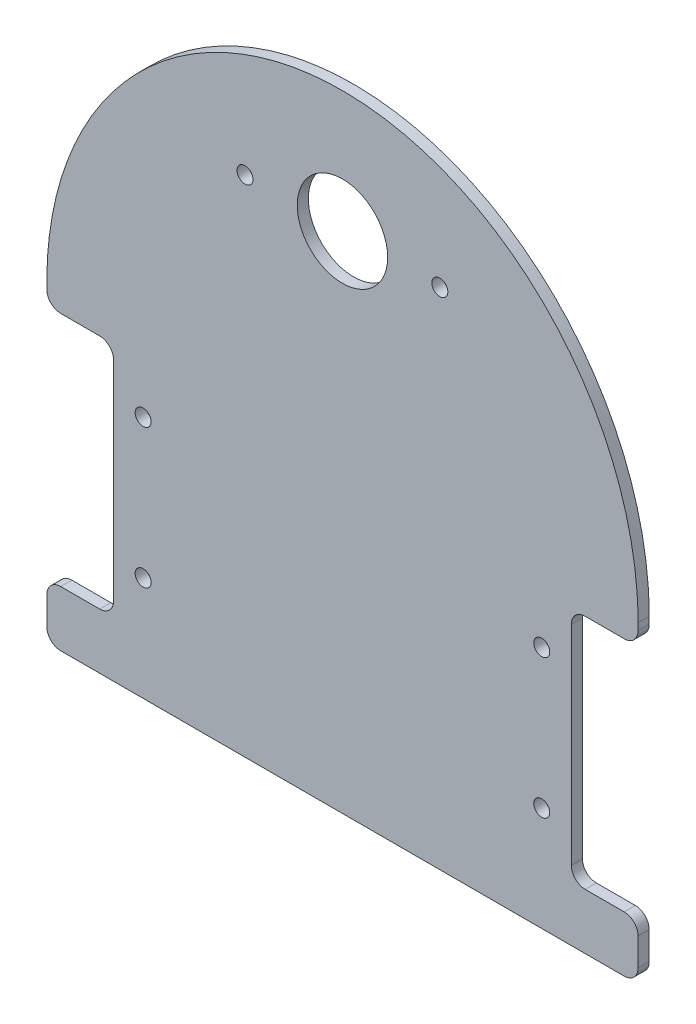
from build123d import *

# Parameters (mm, degrees)
SKETCH1_W           = 85
SKETCH1_H           = 90
BOSS_EXTRUDE1_DEPTH = 1.6
CUT_EXTRUDE1_DEPTH  = 62.917768048
SKETCH3_W           = 9.6
SKETCH3_H           = 34
CUT_EXTRUDE2_DEPTH  = 62.917768192
SKETCH4_R           = 6.5
CUT_EXTRUDE3_DEPTH  = 62.917768192
SKETCH5_R           = 1.15
CUT_EXTRUDE4_DEPTH  = 62.917768192
SKETCH6_R           = 1.15
CUT_EXTRUDE5_DEPTH  = 62.917768192
FILLET1_R           = 2


with BuildPart() as part:
    # Sketch1 → Boss-Extrude1 (new body)
    with BuildSketch(Plane.XY):
        Rectangle(SKETCH1_W, SKETCH1_H)
    extrude(amount=BOSS_EXTRUDE1_DEPTH)

    # Sketch2 → Cut-Extrude1 (cut, through all)
    with BuildSketch(Plane.XY.offset(1.6)):
        with BuildLine():
            Line((-42.5, 0), (-70, 0))
            Line((-70, 0), (-70, 70))
            Line((-70, 70), (70, 70))
            Line((70, 70), (70, 0))
            Line((70, 0), (42.5, 0))
            add(Edge.make_bspline(
                [(42.5, 0), (42.5, 45), (0, 45), (-42.5, 45), (-42.5, 0)],
                knots=[1.570796327, 1.570796327, 1.570796327, 3.141592654, 3.141592654, 4.71238898, 4.71238898, 4.71238898], degree=2, weights=[1, 0.707106781, 1, 0.707106781, 1]))
        make_face()
    extrude(amount=-CUT_EXTRUDE1_DEPTH, mode=Mode.SUBTRACT)

    # Sketch3 → Cut-Extrude2 (cut, through all)
    with BuildSketch(Plane.XY.offset(1.6)):
        with Locations((-37.7, -20)):
            Rectangle(SKETCH3_W, SKETCH3_H)
        with Locations((37.7, -20)):
            Rectangle(SKETCH3_W, SKETCH3_H)
    extrude(amount=-CUT_EXTRUDE2_DEPTH, mode=Mode.SUBTRACT)

    # Sketch4 → Cut-Extrude3 (cut, through all)
    with BuildSketch(Plane.XY.offset(1.6)):
        with Locations((0, 27.5)):
            Circle(SKETCH4_R)
    extrude(amount=-CUT_EXTRUDE3_DEPTH, mode=Mode.SUBTRACT)

    # Sketch5 → Cut-Extrude4 (cut, through all)
    with BuildSketch(Plane.XY.offset(1.6)):
        with Locations((-28.65, -10)):
            Circle(SKETCH5_R)
        with Locations((-28.65, -30)):
            Circle(SKETCH5_R)
        with Locations((28.65, -30)):
            Circle(SKETCH5_R)
        with Locations((28.65, -10)):
            Circle(SKETCH5_R)
    extrude(amount=-CUT_EXTRUDE4_DEPTH, mode=Mode.SUBTRACT)

    # Sketch6 → Cut-Extrude5 (cut, through all)
    with BuildSketch(Plane.XY.offset(1.6)):
        with Locations((-14, 27.5)):
            Circle(SKETCH6_R)
        with Locations((14, 27.5)):
            Circle(SKETCH6_R)
    extrude(amount=-CUT_EXTRUDE5_DEPTH, mode=Mode.SUBTRACT)

    # Fillet1
    fillet1_edges = [part.edges().sort_by_distance(p)[0] for p in [
        (42.5, -37, 0.8),
        (32.9, -37, 0.8),
        (32.9, -3, 0.8),
        (42.5, -3, 0.8),
        (-32.9, -37, 0.8),
        (-32.9, -3, 0.8),
        (-42.5, -37, 0.8),
        (-42.5, -3, 0.8),
        (42.5, -45, 0.8),
        (-42.5, -45, 0.8),
    ]]
    fillet(fillet1_edges, radius=FILLET1_R)


solid = part.part
